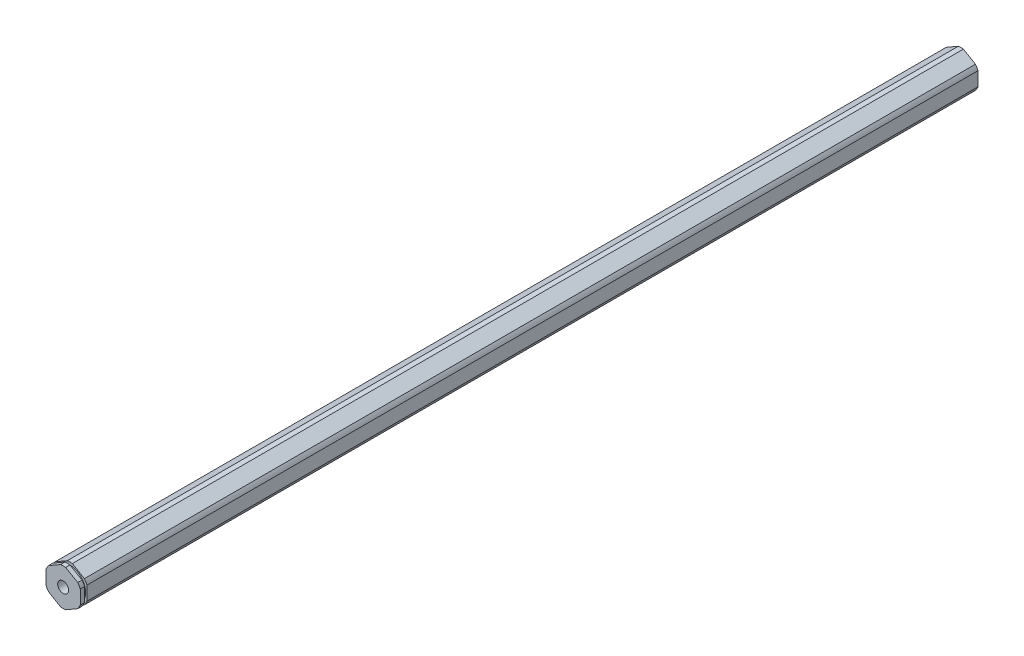
from build123d import *

# Parameters (mm, degrees)
BOSS_EXTRUDE1_DEPTH                  = 166.33825
F_10_32_TAPPED_HOLE1_D               = 4.0386
F_10_32_TAPPED_HOLE1_DEPTH           = 16.34744
F_10_32_TAPPED_HOLE1_TIP             = 1.213317848
F_10_32_TAPPED_HOLE1_ON_FACE_2_D     = 4.0386
F_10_32_TAPPED_HOLE1_ON_FACE_2_DEPTH = 16.34744
F_10_32_TAPPED_HOLE1_ON_FACE_2_TIP   = 1.213317848
SKETCH5_W                            = 0.889
SKETCH5_H                            = 1.0033


with BuildPart() as part:
    # Sketch1 → Boss-Extrude1 (new, symmetric)
    with BuildSketch(Plane.XY):
        with BuildLine():
            ThreePointArc((0.93173274, 6.79441227), (0, 6.858), (-0.93173274, 6.79441227))
            Line((-0.93173274, 6.79441227), (-5.41826726, 4.204110358))
            ThreePointArc((-5.41826726, 4.204110358), (-5.939202219, 3.429), (-6.35, 2.590301913))
            Line((-6.35, 2.590301913), (-6.35, -2.590301913))
            ThreePointArc((-6.35, -2.590301913), (-5.939202219, -3.429), (-5.41826726, -4.204110358))
            Line((-5.41826726, -4.204110358), (-0.93173274, -6.79441227))
            ThreePointArc((-0.93173274, -6.79441227), (0, -6.858), (0.93173274, -6.79441227))
            Line((0.93173274, -6.79441227), (5.41826726, -4.204110358))
            ThreePointArc((5.41826726, -4.204110358), (5.939202219, -3.429), (6.35, -2.590301913))
            Line((6.35, -2.590301913), (6.35, 2.590301913))
            ThreePointArc((6.35, 2.590301913), (5.939202219, 3.429), (5.41826726, 4.204110358))
            Line((5.41826726, 4.204110358), (0.93173274, 6.79441227))
        make_face()
    extrude(amount=BOSS_EXTRUDE1_DEPTH, both=True)

    # #10-32 Tapped Hole1
    with Locations(Plane.XY.offset(166.33825)):
        with Locations((0, 0)):
            Hole(F_10_32_TAPPED_HOLE1_D / 2, depth=F_10_32_TAPPED_HOLE1_DEPTH)
            with Locations((0, 0, -(F_10_32_TAPPED_HOLE1_DEPTH + F_10_32_TAPPED_HOLE1_TIP / 2))):  # 118° drill point
                Cone(0, F_10_32_TAPPED_HOLE1_D / 2, F_10_32_TAPPED_HOLE1_TIP, mode=Mode.SUBTRACT)

    # #10-32 Tapped Hole1 on face 2
    with Locations(Plane(origin=(0, 0, -166.33825), x_dir=(-1, 0, 0), z_dir=(0, 0, -1))):
        with Locations((0, 0)):
            Hole(F_10_32_TAPPED_HOLE1_ON_FACE_2_D / 2, depth=F_10_32_TAPPED_HOLE1_ON_FACE_2_DEPTH)
            with Locations((0, 0, -(F_10_32_TAPPED_HOLE1_ON_FACE_2_DEPTH + F_10_32_TAPPED_HOLE1_ON_FACE_2_TIP / 2))):  # 118° drill point
                Cone(0, F_10_32_TAPPED_HOLE1_ON_FACE_2_D / 2, F_10_32_TAPPED_HOLE1_ON_FACE_2_TIP, mode=Mode.SUBTRACT)

    # Sketch5 → Cut-Revolve1 (revolve, cut)
    with BuildSketch(Plane(origin=(0, 0, 0), x_dir=(0, 0, -1), z_dir=(1, 0, 0))):
        with Locations((-164.30625, 6.35635)):
            Rectangle(SKETCH5_W, SKETCH5_H)
    revolve(axis=Axis((0, 0, 165.047176272), (0, 0, -1)), mode=Mode.SUBTRACT)


solid = part.part
